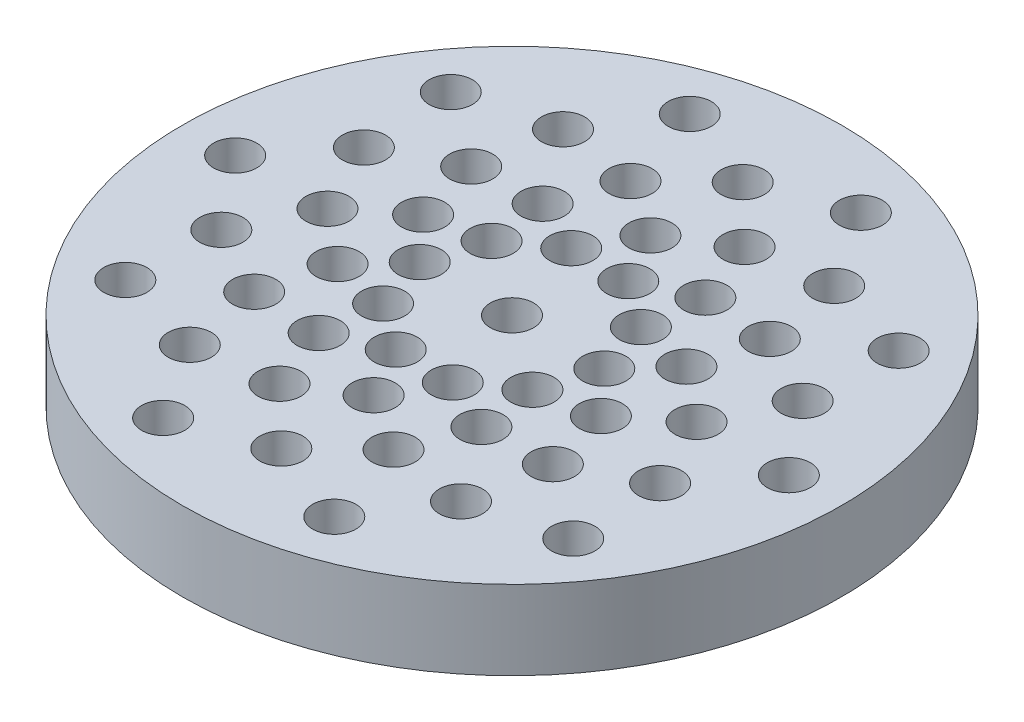
from build123d import *

# Parameters (mm, degrees)
SKETCH1_R                    = 25
BOSS_EXTRUDE1_DEPTH          = 6
SKETCH2_R                    = 1.6375
CUT_EXTRUDE1_DEPTH           = 36.860842154
LPATTERN1_COUNT              = 4
LPATTERN1_PITCH              = 7
SKETCH3_R                    = 1.6375
CUT_EXTRUDE2_DEPTH           = 36.860842154
LPATTERN2_COUNT              = 2
LPATTERN2_PITCH              = 7
CIRPATTERN1_COPY_1_SKETCH_R  = 1.6375
CIRPATTERN1_COPY_1_DEPTH     = 36.860842154
CIRPATTERN1_COPY_2_SKETCH_R  = 1.6375
CIRPATTERN1_COPY_2_DEPTH     = 36.860842154
CIRPATTERN1_COPY_3_SKETCH_R  = 1.6375
CIRPATTERN1_COPY_3_DEPTH     = 36.860842154
CIRPATTERN1_COPY_4_SKETCH_R  = 1.6375
CIRPATTERN1_COPY_4_DEPTH     = 36.860842154
CIRPATTERN1_COPY_5_SKETCH_R  = 1.6375
CIRPATTERN1_COPY_5_DEPTH     = 36.860842154
CIRPATTERN1_COPY_6_SKETCH_R  = 1.6375
CIRPATTERN1_COPY_6_DEPTH     = 36.860842154
CIRPATTERN1_COPY_7_SKETCH_R  = 1.6375
CIRPATTERN1_COPY_7_DEPTH     = 36.860842154
CIRPATTERN1_COPY_8_SKETCH_R  = 1.6375
CIRPATTERN1_COPY_8_DEPTH     = 36.860842154
CIRPATTERN1_COPY_9_SKETCH_R  = 1.6375
CIRPATTERN1_COPY_9_DEPTH     = 36.860842154
CIRPATTERN1_COPY_10_SKETCH_R = 1.6375
CIRPATTERN1_COPY_10_DEPTH    = 36.860842154
CIRPATTERN1_COPY_11_SKETCH_R = 1.6375
CIRPATTERN1_COPY_11_DEPTH    = 36.860842154
CIRPATTERN1_COPY_12_SKETCH_R = 1.6375
CIRPATTERN1_COPY_12_DEPTH    = 36.860842154
CIRPATTERN1_COPY_13_SKETCH_R = 1.6375
CIRPATTERN1_COPY_13_DEPTH    = 36.860842154
CIRPATTERN1_COPY_14_SKETCH_R = 1.6375
CIRPATTERN1_COPY_14_DEPTH    = 36.860842154
CIRPATTERN1_COPY_15_SKETCH_R = 1.6375
CIRPATTERN1_COPY_15_DEPTH    = 36.860842154
CIRPATTERN1_COPY_16_SKETCH_R = 1.6375
CIRPATTERN1_COPY_16_DEPTH    = 36.860842154
CIRPATTERN1_COPY_17_SKETCH_R = 1.6375
CIRPATTERN1_COPY_17_DEPTH    = 36.860842154
CIRPATTERN1_COPY_18_SKETCH_R = 1.6375
CIRPATTERN1_COPY_18_DEPTH    = 36.860842154
CIRPATTERN1_COPY_19_SKETCH_R = 1.6375
CIRPATTERN1_COPY_19_DEPTH    = 36.860842154
CIRPATTERN1_COPY_20_SKETCH_R = 1.6375
CIRPATTERN1_COPY_20_DEPTH    = 36.860842154
CIRPATTERN1_COPY_21_SKETCH_R = 1.6375
CIRPATTERN1_COPY_21_DEPTH    = 36.860842154
CIRPATTERN1_COPY_22_SKETCH_R = 1.6375
CIRPATTERN1_COPY_22_DEPTH    = 36.860842154
CIRPATTERN1_COPY_23_SKETCH_R = 1.6375
CIRPATTERN1_COPY_23_DEPTH    = 36.860842154
CIRPATTERN1_COPY_24_SKETCH_R = 1.6375
CIRPATTERN1_COPY_24_DEPTH    = 36.860842154
CIRPATTERN1_COPY_25_SKETCH_R = 1.6375
CIRPATTERN1_COPY_25_DEPTH    = 36.860842154
CIRPATTERN1_COPY_26_SKETCH_R = 1.6375
CIRPATTERN1_COPY_26_DEPTH    = 36.860842154
CIRPATTERN1_COPY_27_SKETCH_R = 1.6375
CIRPATTERN1_COPY_27_DEPTH    = 36.860842154
CIRPATTERN1_COPY_28_SKETCH_R = 1.6375
CIRPATTERN1_COPY_28_DEPTH    = 36.860842154
CIRPATTERN1_COPY_29_SKETCH_R = 1.6375
CIRPATTERN1_COPY_29_DEPTH    = 36.860842154
CIRPATTERN1_COPY_30_SKETCH_R = 1.6375
CIRPATTERN1_COPY_30_DEPTH    = 36.860842154
CIRPATTERN1_COPY_31_SKETCH_R = 1.6375
CIRPATTERN1_COPY_31_DEPTH    = 36.860842154
CIRPATTERN1_COPY_32_SKETCH_R = 1.6375
CIRPATTERN1_COPY_32_DEPTH    = 36.860842154
CIRPATTERN1_COPY_33_SKETCH_R = 1.6375
CIRPATTERN1_COPY_33_DEPTH    = 36.860842154
CIRPATTERN1_COPY_34_SKETCH_R = 1.6375
CIRPATTERN1_COPY_34_DEPTH    = 36.860842154
CIRPATTERN1_COPY_35_SKETCH_R = 1.6375
CIRPATTERN1_COPY_35_DEPTH    = 36.860842154
CIRPATTERN1_COPY_36_SKETCH_R = 1.6375
CIRPATTERN1_COPY_36_DEPTH    = 36.860842154
CIRPATTERN1_COPY_37_SKETCH_R = 1.6375
CIRPATTERN1_COPY_37_DEPTH    = 36.860842154
CIRPATTERN1_COPY_38_SKETCH_R = 1.6375
CIRPATTERN1_COPY_38_DEPTH    = 36.860842154
CIRPATTERN1_COPY_39_SKETCH_R = 1.6375
CIRPATTERN1_COPY_39_DEPTH    = 36.860842154
CIRPATTERN1_COPY_40_SKETCH_R = 1.6375
CIRPATTERN1_COPY_40_DEPTH    = 36.860842154
CIRPATTERN1_COPY_41_SKETCH_R = 1.6375
CIRPATTERN1_COPY_41_DEPTH    = 36.860842154
CIRPATTERN1_COPY_42_SKETCH_R = 1.6375
CIRPATTERN1_COPY_42_DEPTH    = 36.860842154
CIRPATTERN1_COPY_43_SKETCH_R = 1.6375
CIRPATTERN1_COPY_43_DEPTH    = 36.860842154
CIRPATTERN1_COPY_44_SKETCH_R = 1.6375
CIRPATTERN1_COPY_44_DEPTH    = 36.860842154
CIRPATTERN1_COPY_45_SKETCH_R = 1.6375
CIRPATTERN1_COPY_45_DEPTH    = 36.860842154
CIRPATTERN1_COPY_46_SKETCH_R = 1.6375
CIRPATTERN1_COPY_46_DEPTH    = 36.860842154
CIRPATTERN1_COPY_47_SKETCH_R = 1.6375
CIRPATTERN1_COPY_47_DEPTH    = 36.860842154
CIRPATTERN1_COPY_48_SKETCH_R = 1.6375
CIRPATTERN1_COPY_48_DEPTH    = 36.860842154
CIRPATTERN1_COPY_49_SKETCH_R = 1.6375
CIRPATTERN1_COPY_49_DEPTH    = 36.860842154
CIRPATTERN1_COPY_50_SKETCH_R = 1.6375
CIRPATTERN1_COPY_50_DEPTH    = 36.860842154
CIRPATTERN1_COPY_51_SKETCH_R = 1.6375
CIRPATTERN1_COPY_51_DEPTH    = 36.860842154
CIRPATTERN1_COPY_52_SKETCH_R = 1.6375
CIRPATTERN1_COPY_52_DEPTH    = 36.860842154
CIRPATTERN1_COPY_53_SKETCH_R = 1.6375
CIRPATTERN1_COPY_53_DEPTH    = 36.860842154
CIRPATTERN1_COPY_54_SKETCH_R = 1.6375
CIRPATTERN1_COPY_54_DEPTH    = 36.860842154


with BuildPart() as part:
    # Sketch1 → Boss-Extrude1 (new body)
    with BuildSketch(Plane(origin=(0, 0, 0), x_dir=(1, 0, 0), z_dir=(0, 1, 0))):
        Circle(SKETCH1_R)
    extrude(amount=BOSS_EXTRUDE1_DEPTH)

    # Sketch2 → Cut-Extrude1 (cut, through all)
    with BuildSketch(Plane(origin=(0, 0, 0), x_dir=(-1, 0, 0), z_dir=(0, -1, 0))):
        Circle(SKETCH2_R)
    cut_extrude1 = extrude(amount=-CUT_EXTRUDE1_DEPTH, mode=Mode.SUBTRACT)

    # LPattern1: Cut-Extrude1 ×4
    with Locations(*[(i * LPATTERN1_PITCH, 0, 0) for i in range(1, LPATTERN1_COUNT)]):
        add(cut_extrude1, mode=Mode.SUBTRACT)

    # Sketch3 → Cut-Extrude2 (cut, through all)
    with BuildSketch(Plane.XZ):
        with Locations((0, -10.5)):
            Circle(SKETCH3_R)
    cut_extrude2 = extrude(amount=-CUT_EXTRUDE2_DEPTH, mode=Mode.SUBTRACT)

    # LPattern2: Cut-Extrude2 ×2
    with Locations(*[(0, 0, -i * LPATTERN2_PITCH) for i in range(1, LPATTERN2_COUNT)]):
        add(cut_extrude2, mode=Mode.SUBTRACT)

    # CirPattern1 copy 1 sketch → CirPattern1 copy 1 (cut, through all)
    with BuildSketch(Plane(origin=(5.663118961, 0, 4.114496766), x_dir=(-0.8090169943749475, 0, -0.5877852522924731), z_dir=(0, -1, 0))):
        Circle(CIRPATTERN1_COPY_1_SKETCH_R)
    extrude(amount=-CIRPATTERN1_COPY_1_DEPTH, mode=Mode.SUBTRACT)

    # CirPattern1 copy 2 sketch → CirPattern1 copy 2 (cut, through all)
    with BuildSketch(Plane(origin=(2.163118961, 0, 6.657395614), x_dir=(-0.30901699437494745, 0, -0.9510565162951535), z_dir=(0, -1, 0))):
        Circle(CIRPATTERN1_COPY_2_SKETCH_R)
    extrude(amount=-CIRPATTERN1_COPY_2_DEPTH, mode=Mode.SUBTRACT)

    # CirPattern1 copy 3 sketch → CirPattern1 copy 3 (cut, through all)
    with BuildSketch(Plane(origin=(-2.163118961, 0, 6.657395614), x_dir=(0.30901699437494734, 0, -0.9510565162951536), z_dir=(0, -1, 0))):
        Circle(CIRPATTERN1_COPY_3_SKETCH_R)
    extrude(amount=-CIRPATTERN1_COPY_3_DEPTH, mode=Mode.SUBTRACT)

    # CirPattern1 copy 4 sketch → CirPattern1 copy 4 (cut, through all)
    with BuildSketch(Plane(origin=(-5.663118961, 0, 4.114496766), x_dir=(0.8090169943749473, 0, -0.5877852522924732), z_dir=(0, -1, 0))):
        Circle(CIRPATTERN1_COPY_4_SKETCH_R)
    extrude(amount=-CIRPATTERN1_COPY_4_DEPTH, mode=Mode.SUBTRACT)

    # CirPattern1 copy 5 sketch → CirPattern1 copy 5 (cut, through all)
    with BuildSketch(Plane(origin=(-7, 0, 0), x_dir=(1, 0, 0), z_dir=(0, -1, 0))):
        Circle(CIRPATTERN1_COPY_5_SKETCH_R)
    extrude(amount=-CIRPATTERN1_COPY_5_DEPTH, mode=Mode.SUBTRACT)

    # CirPattern1 copy 6 sketch → CirPattern1 copy 6 (cut, through all)
    with BuildSketch(Plane(origin=(-5.663118961, 0, -4.114496766), x_dir=(0.8090169943749476, 0, 0.587785252292473), z_dir=(0, -1, 0))):
        Circle(CIRPATTERN1_COPY_6_SKETCH_R)
    extrude(amount=-CIRPATTERN1_COPY_6_DEPTH, mode=Mode.SUBTRACT)

    # CirPattern1 copy 7 sketch → CirPattern1 copy 7 (cut, through all)
    with BuildSketch(Plane(origin=(-2.163118961, 0, -6.657395614), x_dir=(0.30901699437494756, 0, 0.9510565162951535), z_dir=(0, -1, 0))):
        Circle(CIRPATTERN1_COPY_7_SKETCH_R)
    extrude(amount=-CIRPATTERN1_COPY_7_DEPTH, mode=Mode.SUBTRACT)

    # CirPattern1 copy 8 sketch → CirPattern1 copy 8 (cut, through all)
    with BuildSketch(Plane(origin=(2.163118961, 0, -6.657395614), x_dir=(-0.30901699437494723, 0, 0.9510565162951536), z_dir=(0, -1, 0))):
        Circle(CIRPATTERN1_COPY_8_SKETCH_R)
    extrude(amount=-CIRPATTERN1_COPY_8_DEPTH, mode=Mode.SUBTRACT)

    # CirPattern1 copy 9 sketch → CirPattern1 copy 9 (cut, through all)
    with BuildSketch(Plane(origin=(5.663118961, 0, -4.114496766), x_dir=(-0.8090169943749473, 0, 0.5877852522924734), z_dir=(0, -1, 0))):
        Circle(CIRPATTERN1_COPY_9_SKETCH_R)
    extrude(amount=-CIRPATTERN1_COPY_9_DEPTH, mode=Mode.SUBTRACT)

    # CirPattern1 copy 10 sketch → CirPattern1 copy 10 (cut, through all)
    with BuildSketch(Plane(origin=(11.326237921, 0, 8.228993532), x_dir=(-0.8090169943749475, 0, -0.5877852522924731), z_dir=(0, -1, 0))):
        Circle(CIRPATTERN1_COPY_10_SKETCH_R)
    extrude(amount=-CIRPATTERN1_COPY_10_DEPTH, mode=Mode.SUBTRACT)

    # CirPattern1 copy 11 sketch → CirPattern1 copy 11 (cut, through all)
    with BuildSketch(Plane(origin=(4.326237921, 0, 13.314791228), x_dir=(-0.30901699437494745, 0, -0.9510565162951535), z_dir=(0, -1, 0))):
        Circle(CIRPATTERN1_COPY_11_SKETCH_R)
    extrude(amount=-CIRPATTERN1_COPY_11_DEPTH, mode=Mode.SUBTRACT)

    # CirPattern1 copy 12 sketch → CirPattern1 copy 12 (cut, through all)
    with BuildSketch(Plane(origin=(-4.326237921, 0, 13.314791228), x_dir=(0.30901699437494734, 0, -0.9510565162951536), z_dir=(0, -1, 0))):
        Circle(CIRPATTERN1_COPY_12_SKETCH_R)
    extrude(amount=-CIRPATTERN1_COPY_12_DEPTH, mode=Mode.SUBTRACT)

    # CirPattern1 copy 13 sketch → CirPattern1 copy 13 (cut, through all)
    with BuildSketch(Plane(origin=(-11.326237921, 0, 8.228993532), x_dir=(0.8090169943749473, 0, -0.5877852522924732), z_dir=(0, -1, 0))):
        Circle(CIRPATTERN1_COPY_13_SKETCH_R)
    extrude(amount=-CIRPATTERN1_COPY_13_DEPTH, mode=Mode.SUBTRACT)

    # CirPattern1 copy 14 sketch → CirPattern1 copy 14 (cut, through all)
    with BuildSketch(Plane(origin=(-14, 0, 0), x_dir=(1, 0, 0), z_dir=(0, -1, 0))):
        Circle(CIRPATTERN1_COPY_14_SKETCH_R)
    extrude(amount=-CIRPATTERN1_COPY_14_DEPTH, mode=Mode.SUBTRACT)

    # CirPattern1 copy 15 sketch → CirPattern1 copy 15 (cut, through all)
    with BuildSketch(Plane(origin=(-11.326237921, 0, -8.228993532), x_dir=(0.8090169943749476, 0, 0.587785252292473), z_dir=(0, -1, 0))):
        Circle(CIRPATTERN1_COPY_15_SKETCH_R)
    extrude(amount=-CIRPATTERN1_COPY_15_DEPTH, mode=Mode.SUBTRACT)

    # CirPattern1 copy 16 sketch → CirPattern1 copy 16 (cut, through all)
    with BuildSketch(Plane(origin=(-4.326237921, 0, -13.314791228), x_dir=(0.30901699437494756, 0, 0.9510565162951535), z_dir=(0, -1, 0))):
        Circle(CIRPATTERN1_COPY_16_SKETCH_R)
    extrude(amount=-CIRPATTERN1_COPY_16_DEPTH, mode=Mode.SUBTRACT)

    # CirPattern1 copy 17 sketch → CirPattern1 copy 17 (cut, through all)
    with BuildSketch(Plane(origin=(4.326237921, 0, -13.314791228), x_dir=(-0.30901699437494723, 0, 0.9510565162951536), z_dir=(0, -1, 0))):
        Circle(CIRPATTERN1_COPY_17_SKETCH_R)
    extrude(amount=-CIRPATTERN1_COPY_17_DEPTH, mode=Mode.SUBTRACT)

    # CirPattern1 copy 18 sketch → CirPattern1 copy 18 (cut, through all)
    with BuildSketch(Plane(origin=(11.326237921, 0, -8.228993532), x_dir=(-0.8090169943749473, 0, 0.5877852522924734), z_dir=(0, -1, 0))):
        Circle(CIRPATTERN1_COPY_18_SKETCH_R)
    extrude(amount=-CIRPATTERN1_COPY_18_DEPTH, mode=Mode.SUBTRACT)

    # CirPattern1 copy 19 sketch → CirPattern1 copy 19 (cut, through all)
    with BuildSketch(Plane(origin=(16.989356882, 0, 12.343490298), x_dir=(-0.8090169943749475, 0, -0.5877852522924731), z_dir=(0, -1, 0))):
        Circle(CIRPATTERN1_COPY_19_SKETCH_R)
    extrude(amount=-CIRPATTERN1_COPY_19_DEPTH, mode=Mode.SUBTRACT)

    # CirPattern1 copy 20 sketch → CirPattern1 copy 20 (cut, through all)
    with BuildSketch(Plane(origin=(6.489356882, 0, 19.972186842), x_dir=(-0.30901699437494745, 0, -0.9510565162951535), z_dir=(0, -1, 0))):
        Circle(CIRPATTERN1_COPY_20_SKETCH_R)
    extrude(amount=-CIRPATTERN1_COPY_20_DEPTH, mode=Mode.SUBTRACT)

    # CirPattern1 copy 21 sketch → CirPattern1 copy 21 (cut, through all)
    with BuildSketch(Plane(origin=(-6.489356882, 0, 19.972186842), x_dir=(0.30901699437494734, 0, -0.9510565162951536), z_dir=(0, -1, 0))):
        Circle(CIRPATTERN1_COPY_21_SKETCH_R)
    extrude(amount=-CIRPATTERN1_COPY_21_DEPTH, mode=Mode.SUBTRACT)

    # CirPattern1 copy 22 sketch → CirPattern1 copy 22 (cut, through all)
    with BuildSketch(Plane(origin=(-16.989356882, 0, 12.343490298), x_dir=(0.8090169943749473, 0, -0.5877852522924732), z_dir=(0, -1, 0))):
        Circle(CIRPATTERN1_COPY_22_SKETCH_R)
    extrude(amount=-CIRPATTERN1_COPY_22_DEPTH, mode=Mode.SUBTRACT)

    # CirPattern1 copy 23 sketch → CirPattern1 copy 23 (cut, through all)
    with BuildSketch(Plane(origin=(-21, 0, 0), x_dir=(1, 0, 0), z_dir=(0, -1, 0))):
        Circle(CIRPATTERN1_COPY_23_SKETCH_R)
    extrude(amount=-CIRPATTERN1_COPY_23_DEPTH, mode=Mode.SUBTRACT)

    # CirPattern1 copy 24 sketch → CirPattern1 copy 24 (cut, through all)
    with BuildSketch(Plane(origin=(-16.989356882, 0, -12.343490298), x_dir=(0.8090169943749476, 0, 0.587785252292473), z_dir=(0, -1, 0))):
        Circle(CIRPATTERN1_COPY_24_SKETCH_R)
    extrude(amount=-CIRPATTERN1_COPY_24_DEPTH, mode=Mode.SUBTRACT)

    # CirPattern1 copy 25 sketch → CirPattern1 copy 25 (cut, through all)
    with BuildSketch(Plane(origin=(-6.489356882, 0, -19.972186842), x_dir=(0.30901699437494756, 0, 0.9510565162951535), z_dir=(0, -1, 0))):
        Circle(CIRPATTERN1_COPY_25_SKETCH_R)
    extrude(amount=-CIRPATTERN1_COPY_25_DEPTH, mode=Mode.SUBTRACT)

    # CirPattern1 copy 26 sketch → CirPattern1 copy 26 (cut, through all)
    with BuildSketch(Plane(origin=(6.489356882, 0, -19.972186842), x_dir=(-0.30901699437494723, 0, 0.9510565162951536), z_dir=(0, -1, 0))):
        Circle(CIRPATTERN1_COPY_26_SKETCH_R)
    extrude(amount=-CIRPATTERN1_COPY_26_DEPTH, mode=Mode.SUBTRACT)

    # CirPattern1 copy 27 sketch → CirPattern1 copy 27 (cut, through all)
    with BuildSketch(Plane(origin=(16.989356882, 0, -12.343490298), x_dir=(-0.8090169943749473, 0, 0.5877852522924734), z_dir=(0, -1, 0))):
        Circle(CIRPATTERN1_COPY_27_SKETCH_R)
    extrude(amount=-CIRPATTERN1_COPY_27_DEPTH, mode=Mode.SUBTRACT)

    # CirPattern1 copy 28 sketch → CirPattern1 copy 28 (cut, through all)
    with BuildSketch(Plane(origin=(0, 0, 0), x_dir=(-0.8090169943749475, 0, -0.5877852522924731), z_dir=(0, -1, 0))):
        Circle(CIRPATTERN1_COPY_28_SKETCH_R)
    extrude(amount=-CIRPATTERN1_COPY_28_DEPTH, mode=Mode.SUBTRACT)

    # CirPattern1 copy 29 sketch → CirPattern1 copy 29 (cut, through all)
    with BuildSketch(Plane(origin=(0, 0, 0), x_dir=(-0.30901699437494745, 0, -0.9510565162951535), z_dir=(0, -1, 0))):
        Circle(CIRPATTERN1_COPY_29_SKETCH_R)
    extrude(amount=-CIRPATTERN1_COPY_29_DEPTH, mode=Mode.SUBTRACT)

    # CirPattern1 copy 30 sketch → CirPattern1 copy 30 (cut, through all)
    with BuildSketch(Plane(origin=(0, 0, 0), x_dir=(0.30901699437494734, 0, -0.9510565162951536), z_dir=(0, -1, 0))):
        Circle(CIRPATTERN1_COPY_30_SKETCH_R)
    extrude(amount=-CIRPATTERN1_COPY_30_DEPTH, mode=Mode.SUBTRACT)

    # CirPattern1 copy 31 sketch → CirPattern1 copy 31 (cut, through all)
    with BuildSketch(Plane(origin=(0, 0, 0), x_dir=(0.8090169943749473, 0, -0.5877852522924732), z_dir=(0, -1, 0))):
        Circle(CIRPATTERN1_COPY_31_SKETCH_R)
    extrude(amount=-CIRPATTERN1_COPY_31_DEPTH, mode=Mode.SUBTRACT)

    # CirPattern1 copy 32 sketch → CirPattern1 copy 32 (cut, through all)
    with BuildSketch(Plane.XZ):
        Circle(CIRPATTERN1_COPY_32_SKETCH_R)
    extrude(amount=-CIRPATTERN1_COPY_32_DEPTH, mode=Mode.SUBTRACT)

    # CirPattern1 copy 33 sketch → CirPattern1 copy 33 (cut, through all)
    with BuildSketch(Plane(origin=(0, 0, 0), x_dir=(0.8090169943749476, 0, 0.587785252292473), z_dir=(0, -1, 0))):
        Circle(CIRPATTERN1_COPY_33_SKETCH_R)
    extrude(amount=-CIRPATTERN1_COPY_33_DEPTH, mode=Mode.SUBTRACT)

    # CirPattern1 copy 34 sketch → CirPattern1 copy 34 (cut, through all)
    with BuildSketch(Plane(origin=(0, 0, 0), x_dir=(0.30901699437494756, 0, 0.9510565162951535), z_dir=(0, -1, 0))):
        Circle(CIRPATTERN1_COPY_34_SKETCH_R)
    extrude(amount=-CIRPATTERN1_COPY_34_DEPTH, mode=Mode.SUBTRACT)

    # CirPattern1 copy 35 sketch → CirPattern1 copy 35 (cut, through all)
    with BuildSketch(Plane(origin=(0, 0, 0), x_dir=(-0.30901699437494723, 0, 0.9510565162951536), z_dir=(0, -1, 0))):
        Circle(CIRPATTERN1_COPY_35_SKETCH_R)
    extrude(amount=-CIRPATTERN1_COPY_35_DEPTH, mode=Mode.SUBTRACT)

    # CirPattern1 copy 36 sketch → CirPattern1 copy 36 (cut, through all)
    with BuildSketch(Plane(origin=(0, 0, 0), x_dir=(-0.8090169943749473, 0, 0.5877852522924734), z_dir=(0, -1, 0))):
        Circle(CIRPATTERN1_COPY_36_SKETCH_R)
    extrude(amount=-CIRPATTERN1_COPY_36_DEPTH, mode=Mode.SUBTRACT)

    # CirPattern1 copy 37 sketch → CirPattern1 copy 37 (cut, through all)
    with BuildSketch(Plane(origin=(4.114496766, 0, -5.663118961), x_dir=(0.8090169943749475, 0, 0.5877852522924731), z_dir=(0, -1, 0))):
        with Locations((0, -10.5)):
            Circle(CIRPATTERN1_COPY_37_SKETCH_R)
    extrude(amount=-CIRPATTERN1_COPY_37_DEPTH, mode=Mode.SUBTRACT)

    # CirPattern1 copy 38 sketch → CirPattern1 copy 38 (cut, through all)
    with BuildSketch(Plane(origin=(6.657395614, 0, -2.163118961), x_dir=(0.30901699437494745, 0, 0.9510565162951535), z_dir=(0, -1, 0))):
        with Locations((0, -10.5)):
            Circle(CIRPATTERN1_COPY_38_SKETCH_R)
    extrude(amount=-CIRPATTERN1_COPY_38_DEPTH, mode=Mode.SUBTRACT)

    # CirPattern1 copy 39 sketch → CirPattern1 copy 39 (cut, through all)
    with BuildSketch(Plane(origin=(6.657395614, 0, 2.163118961), x_dir=(-0.30901699437494734, 0, 0.9510565162951536), z_dir=(0, -1, 0))):
        with Locations((0, -10.5)):
            Circle(CIRPATTERN1_COPY_39_SKETCH_R)
    extrude(amount=-CIRPATTERN1_COPY_39_DEPTH, mode=Mode.SUBTRACT)

    # CirPattern1 copy 40 sketch → CirPattern1 copy 40 (cut, through all)
    with BuildSketch(Plane(origin=(4.114496766, 0, 5.663118961), x_dir=(-0.8090169943749473, 0, 0.5877852522924732), z_dir=(0, -1, 0))):
        with Locations((0, -10.5)):
            Circle(CIRPATTERN1_COPY_40_SKETCH_R)
    extrude(amount=-CIRPATTERN1_COPY_40_DEPTH, mode=Mode.SUBTRACT)

    # CirPattern1 copy 41 sketch → CirPattern1 copy 41 (cut, through all)
    with BuildSketch(Plane(origin=(0, 0, 7), x_dir=(-1, 0, 0), z_dir=(0, -1, 0))):
        with Locations((0, -10.5)):
            Circle(CIRPATTERN1_COPY_41_SKETCH_R)
    extrude(amount=-CIRPATTERN1_COPY_41_DEPTH, mode=Mode.SUBTRACT)

    # CirPattern1 copy 42 sketch → CirPattern1 copy 42 (cut, through all)
    with BuildSketch(Plane(origin=(-4.114496766, 0, 5.663118961), x_dir=(-0.8090169943749476, 0, -0.587785252292473), z_dir=(0, -1, 0))):
        with Locations((0, -10.5)):
            Circle(CIRPATTERN1_COPY_42_SKETCH_R)
    extrude(amount=-CIRPATTERN1_COPY_42_DEPTH, mode=Mode.SUBTRACT)

    # CirPattern1 copy 43 sketch → CirPattern1 copy 43 (cut, through all)
    with BuildSketch(Plane(origin=(-6.657395614, 0, 2.163118961), x_dir=(-0.30901699437494756, 0, -0.9510565162951535), z_dir=(0, -1, 0))):
        with Locations((0, -10.5)):
            Circle(CIRPATTERN1_COPY_43_SKETCH_R)
    extrude(amount=-CIRPATTERN1_COPY_43_DEPTH, mode=Mode.SUBTRACT)

    # CirPattern1 copy 44 sketch → CirPattern1 copy 44 (cut, through all)
    with BuildSketch(Plane(origin=(-6.657395614, 0, -2.163118961), x_dir=(0.30901699437494723, 0, -0.9510565162951536), z_dir=(0, -1, 0))):
        with Locations((0, -10.5)):
            Circle(CIRPATTERN1_COPY_44_SKETCH_R)
    extrude(amount=-CIRPATTERN1_COPY_44_DEPTH, mode=Mode.SUBTRACT)

    # CirPattern1 copy 45 sketch → CirPattern1 copy 45 (cut, through all)
    with BuildSketch(Plane(origin=(-4.114496766, 0, -5.663118961), x_dir=(0.8090169943749473, 0, -0.5877852522924734), z_dir=(0, -1, 0))):
        with Locations((0, -10.5)):
            Circle(CIRPATTERN1_COPY_45_SKETCH_R)
    extrude(amount=-CIRPATTERN1_COPY_45_DEPTH, mode=Mode.SUBTRACT)

    # CirPattern1 copy 46 sketch → CirPattern1 copy 46 (cut, through all)
    with BuildSketch(Plane(origin=(0, 0, 0), x_dir=(0.8090169943749475, 0, 0.5877852522924731), z_dir=(0, -1, 0))):
        with Locations((0, -10.5)):
            Circle(CIRPATTERN1_COPY_46_SKETCH_R)
    extrude(amount=-CIRPATTERN1_COPY_46_DEPTH, mode=Mode.SUBTRACT)

    # CirPattern1 copy 47 sketch → CirPattern1 copy 47 (cut, through all)
    with BuildSketch(Plane(origin=(0, 0, 0), x_dir=(0.30901699437494745, 0, 0.9510565162951535), z_dir=(0, -1, 0))):
        with Locations((0, -10.5)):
            Circle(CIRPATTERN1_COPY_47_SKETCH_R)
    extrude(amount=-CIRPATTERN1_COPY_47_DEPTH, mode=Mode.SUBTRACT)

    # CirPattern1 copy 48 sketch → CirPattern1 copy 48 (cut, through all)
    with BuildSketch(Plane(origin=(0, 0, 0), x_dir=(-0.30901699437494734, 0, 0.9510565162951536), z_dir=(0, -1, 0))):
        with Locations((0, -10.5)):
            Circle(CIRPATTERN1_COPY_48_SKETCH_R)
    extrude(amount=-CIRPATTERN1_COPY_48_DEPTH, mode=Mode.SUBTRACT)

    # CirPattern1 copy 49 sketch → CirPattern1 copy 49 (cut, through all)
    with BuildSketch(Plane(origin=(0, 0, 0), x_dir=(-0.8090169943749473, 0, 0.5877852522924732), z_dir=(0, -1, 0))):
        with Locations((0, -10.5)):
            Circle(CIRPATTERN1_COPY_49_SKETCH_R)
    extrude(amount=-CIRPATTERN1_COPY_49_DEPTH, mode=Mode.SUBTRACT)

    # CirPattern1 copy 50 sketch → CirPattern1 copy 50 (cut, through all)
    with BuildSketch(Plane(origin=(0, 0, 0), x_dir=(-1, 0, 0), z_dir=(0, -1, 0))):
        with Locations((0, -10.5)):
            Circle(CIRPATTERN1_COPY_50_SKETCH_R)
    extrude(amount=-CIRPATTERN1_COPY_50_DEPTH, mode=Mode.SUBTRACT)

    # CirPattern1 copy 51 sketch → CirPattern1 copy 51 (cut, through all)
    with BuildSketch(Plane(origin=(0, 0, 0), x_dir=(-0.8090169943749476, 0, -0.587785252292473), z_dir=(0, -1, 0))):
        with Locations((0, -10.5)):
            Circle(CIRPATTERN1_COPY_51_SKETCH_R)
    extrude(amount=-CIRPATTERN1_COPY_51_DEPTH, mode=Mode.SUBTRACT)

    # CirPattern1 copy 52 sketch → CirPattern1 copy 52 (cut, through all)
    with BuildSketch(Plane(origin=(0, 0, 0), x_dir=(-0.30901699437494756, 0, -0.9510565162951535), z_dir=(0, -1, 0))):
        with Locations((0, -10.5)):
            Circle(CIRPATTERN1_COPY_52_SKETCH_R)
    extrude(amount=-CIRPATTERN1_COPY_52_DEPTH, mode=Mode.SUBTRACT)

    # CirPattern1 copy 53 sketch → CirPattern1 copy 53 (cut, through all)
    with BuildSketch(Plane(origin=(0, 0, 0), x_dir=(0.30901699437494723, 0, -0.9510565162951536), z_dir=(0, -1, 0))):
        with Locations((0, -10.5)):
            Circle(CIRPATTERN1_COPY_53_SKETCH_R)
    extrude(amount=-CIRPATTERN1_COPY_53_DEPTH, mode=Mode.SUBTRACT)

    # CirPattern1 copy 54 sketch → CirPattern1 copy 54 (cut, through all)
    with BuildSketch(Plane(origin=(0, 0, 0), x_dir=(0.8090169943749473, 0, -0.5877852522924734), z_dir=(0, -1, 0))):
        with Locations((0, -10.5)):
            Circle(CIRPATTERN1_COPY_54_SKETCH_R)
    extrude(amount=-CIRPATTERN1_COPY_54_DEPTH, mode=Mode.SUBTRACT)


solid = part.part
